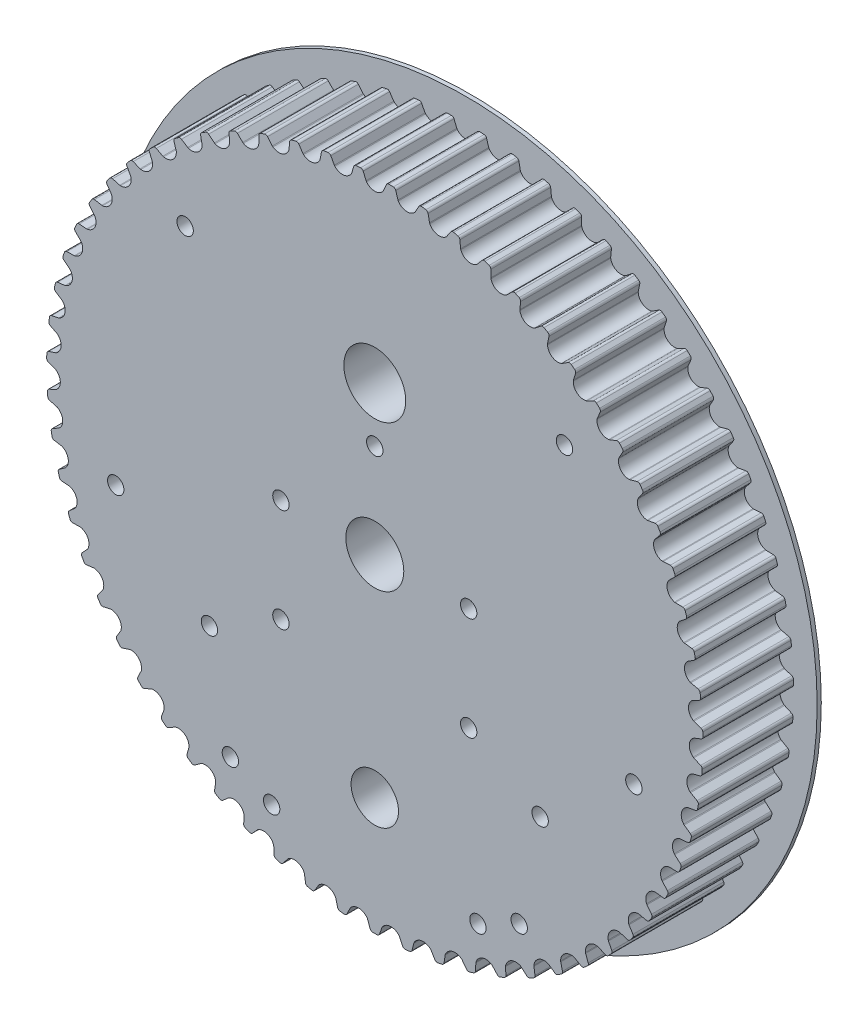
from build123d import *

# Parameters (mm, degrees)
BOSS_EXTRUDE1_DEPTH = 22
SKETCH2_R           = 85.214091318
BOSS_EXTRUDE2_DEPTH = 1
SKETCH3_R           = 7.025
SKETCH3_R_2         = 5.75
SKETCH3_R_3         = 7.5
CUT_EXTRUDE1_DEPTH  = 123.686114611
SKETCH4_R           = 1.985
CUT_EXTRUDE2_DEPTH  = 18


with BuildPart() as part:
    # Sketch1 → Boss-Extrude1 (new body)
    with BuildSketch(Plane.XY):
        with BuildLine():
            ThreePointArc((-2.00858237, 77.225966305), (-2.06415437, 77.308346172), (-2.108533634, 77.397257198))
            Line((-2.108533634, 77.397257198), (-2.806365183, 79.058376339))
            ThreePointArc((-2.806365183, 79.058376339), (-3.057533909, 79.355500397), (-3.433430091, 79.455852257))
            ThreePointArc((-3.433430091, 79.455852257), (-3.69885733, 79.443938437), (-3.964243287, 79.431137945))
            ThreePointArc((-3.964243287, 79.431137945), (-4.229584998, 79.417450921), (-4.494879503, 79.402877519))
            ThreePointArc((-4.494879503, 79.402877519), (-4.858915954, 79.265597157), (-5.079252563, 78.944941245))
            Line((-5.079252563, 78.944941245), (-5.608222375, 77.222594994))
            ThreePointArc((-5.608222375, 77.222594994), (-5.643528429, 77.129707039), (-5.690621893, 77.042203352))
            ThreePointArc((-5.690621893, 77.042203352), (-7.591122322, 75.861842835), (-9.687824439, 76.642222909))
            ThreePointArc((-9.687824439, 76.642222909), (-9.751322675, 76.718660228), (-9.804334089, 76.802710687))
            Line((-9.804334089, 76.802710687), (-10.664092012, 78.386093769))
            ThreePointArc((-10.664092012, 78.386093769), (-10.943596627, 78.656733022), (-11.327616714, 78.719159038))
            ThreePointArc((-11.327616714, 78.719159038), (-11.590538753, 78.680876402), (-11.853331429, 78.64171561))
            ThreePointArc((-11.853331429, 78.64171561), (-12.11599181, 78.601677097), (-12.378516965, 78.560761311))
            ThreePointArc((-12.378516965, 78.560761311), (-12.727075727, 78.3879168), (-12.914390416, 78.046915859))
            Line((-12.914390416, 78.046915859), (-13.26924135, 76.280459947))
            ThreePointArc((-13.26924135, 76.280459947), (-13.295123307, 76.184518226), (-13.333270199, 76.092760369))
            ThreePointArc((-13.333270199, 76.092760369), (-15.10680066, 74.729036594), (-17.270784557, 75.29677467))
            ThreePointArc((-17.270784557, 75.29677467), (-17.341577955, 75.366509771), (-17.402694666, 75.444864333))
            Line((-17.402694666, 75.444864333), (-18.415834303, 76.934774984))
            ThreePointArc((-18.415834303, 76.934774984), (-18.720896964, 77.176239697), (-19.109224393, 77.20011945))
            ThreePointArc((-19.109224393, 77.20011945), (-19.367028194, 77.135848468), (-19.624615838, 77.070716574))
            ThreePointArc((-19.624615838, 77.070716574), (-19.881984453, 77.004724493), (-20.139131164, 76.937872962))
            ThreePointArc((-20.139131164, 76.937872962), (-20.468748104, 76.73118211), (-20.621179254, 76.373225158))
            Line((-20.621179254, 76.373225158), (-20.798384643, 74.58021542))
            ThreePointArc((-20.798384643, 74.58021542), (-20.814585277, 74.482173443), (-20.843406476, 74.387073348))
            ThreePointArc((-20.843406476, 74.387073348), (-22.472340826, 72.853539614), (-24.682099858, 73.202993255))
            ThreePointArc((-24.682099858, 73.202993255), (-24.759484842, 73.265333081), (-24.828099445, 73.337213021))
            Line((-24.828099445, 73.337213021), (-25.984551758, 74.71884384))
            ThreePointArc((-25.984551758, 74.71884384), (-26.312140616, 74.928734228), (-26.700916015, 74.913830392))
            ThreePointArc((-26.700916015, 74.913830392), (-26.951039407, 74.824209818), (-27.200861999, 74.733754131))
            ThreePointArc((-27.200861999, 74.733754131), (-27.450381001, 74.642464341), (-27.69959363, 74.550341466))
            ThreePointArc((-27.69959363, 74.550341466), (-28.006992866, 74.311858458), (-28.123025549, 73.940503033))
            Line((-28.123025549, 73.940503033), (-28.120824246, 72.138759204))
            ThreePointArc((-28.120824246, 72.138759204), (-28.127182546, 72.039591358), (-28.146391615, 71.942094172))
            ThreePointArc((-28.146391615, 71.942094172), (-29.614540772, 70.253991426), (-31.848113362, 70.381687605))
            ThreePointArc((-31.848113362, 70.381687605), (-31.931320845, 70.436012594), (-32.006751418, 70.500703539))
            Line((-32.006751418, 70.500703539), (-33.295023065, 71.760323257))
            ThreePointArc((-33.295023065, 71.760323257), (-33.641882394, 71.936553336), (-34.027241938, 71.88301403))
            ThreePointArc((-34.027241938, 71.88301403), (-34.267199083, 71.768934554), (-34.506773772, 71.654054064))
            ThreePointArc((-34.506773772, 71.654054064), (-34.745963331, 71.538373844), (-34.98476509, 71.421895183))
            ThreePointArc((-34.98476509, 71.421895183), (-35.26689155, 71.153990171), (-35.345372581, 70.77292697))
            Line((-35.345372581, 70.77292697), (-35.163786463, 68.98035559))
            ThreePointArc((-35.163786463, 68.98035559), (-35.160239239, 68.881047449), (-35.169645269, 68.782122143))
            ThreePointArc((-35.169645269, 68.782122143), (-36.462418108, 66.956227509), (-38.697606007, 66.860897123))
            ThreePointArc((-38.697606007, 66.860897123), (-38.785809036, 66.90666737), (-38.867305915, 66.963526391))
            Line((-38.867305915, 66.963526391), (-40.274593474, 68.088616342))
            ThreePointArc((-40.274593474, 68.088616342), (-40.637276031, 68.229434657), (-41.015389843, 68.137791981))
            ThreePointArc((-41.015389843, 68.137791981), (-41.242795939, 68.000387375), (-41.469741725, 67.862223816))
            ThreePointArc((-41.469741725, 67.862223816), (-41.696224666, 67.723302847), (-41.922242237, 67.583626019))
            ThreePointArc((-41.922242237, 67.583626019), (-42.176292022, 67.288961563), (-42.21644142, 66.901977763))
            Line((-42.21644142, 66.901977763), (-41.857275173, 65.136394212))
            ThreePointArc((-41.857275173, 65.136394212), (-41.843857678, 65.037932745), (-41.843367187, 64.938562482))
            ThreePointArc((-41.843367187, 64.938562482), (-42.947915551, 62.993022521), (-45.162504458, 62.675613008))
            ThreePointArc((-45.162504458, 62.675613008), (-45.254826431, 62.712373626), (-45.341579664, 62.760835633))
            Line((-45.341579664, 62.760835633), (-46.853896879, 63.740214167))
            ThreePointArc((-46.853896879, 63.740214167), (-47.228798161, 63.844221204), (-47.595908377, 63.715385943))
            ThreePointArc((-47.595908377, 63.715385943), (-47.80850336, 63.556021795), (-48.020564753, 63.395948299))
            ThreePointArc((-48.020564753, 63.395948299), (-48.232090189, 63.235167241), (-48.443077306, 63.073680416))
            ThreePointArc((-48.443077306, 63.073680416), (-48.666525555, 62.755185023), (-48.667944298, 62.366126644))
            Line((-48.667944298, 62.366126644), (-48.134767477, 60.645078084))
            ThreePointArc((-48.134767477, 60.645078084), (-48.11161306, 60.548441845), (-48.101230924, 60.449614213))
            ThreePointArc((-48.101230924, 60.449614213), (-49.006577314, 58.403764575), (-51.17855765, 57.867430492))
            ThreePointArc((-51.17855765, 57.867430492), (-51.274081029, 57.894816138), (-51.365228424, 57.934399494))
            Line((-51.365228424, 57.934399494), (-52.967545206, 58.758333108))
            ThreePointArc((-52.967545206, 58.758333108), (-53.350939277, 58.824495197), (-53.70339739, 58.659747773))
            ThreePointArc((-53.70339739, 58.659747773), (-53.899068396, 58.480007918), (-54.094137835, 58.299615367))
            ThreePointArc((-54.094137835, 58.299615367), (-54.288603529, 58.118572134), (-54.482463308, 57.936880239))
            ThreePointArc((-54.482463308, 57.936880239), (-54.673089293, 57.597719261), (-54.635763281, 57.210452939))
            Line((-54.635763281, 57.210452939), (-53.933874836, 55.551043924))
            ThreePointArc((-53.933874836, 55.551043924), (-53.901213616, 55.457193328), (-53.881043017, 55.359890519))
            ThreePointArc((-53.881043017, 55.359890519), (-54.578189694, 53.234063777), (-56.685975343, 52.484135454))
            ThreePointArc((-56.685975343, 52.484135454), (-56.783750775, 52.501873957), (-56.878386467, 52.532185265))
            Line((-56.878386467, 52.532185265), (-58.554778273, 53.192485336))
            ThreePointArc((-58.554778273, 53.192485336), (-58.942854789, 53.220144929), (-59.277157912, 53.021122677))
            ThreePointArc((-59.277157912, 53.021122677), (-59.453960275, 52.822793448), (-59.630099072, 52.623874664))
            ThreePointArc((-59.630099072, 52.623874664), (-59.805572338, 52.424368545), (-59.980378113, 52.224277318))
            ThreePointArc((-59.980378113, 52.224277318), (-60.136287306, 51.867821488), (-60.060587502, 51.48619605))
            Line((-60.060587502, 51.48619605), (-59.196963116, 49.904918532))
            ThreePointArc((-59.196963116, 49.904918532), (-59.155119696, 49.814786308), (-59.125361097, 49.719975362))
            ThreePointArc((-59.125361097, 49.719975362), (-59.607379505, 47.535298937), (-61.630022345, 46.579229498))
            ThreePointArc((-61.630022345, 46.579229498), (-61.729078094, 46.587144566), (-61.826261552, 46.607882577))
            Line((-61.826261552, 46.607882577), (-63.560067646, 47.097986747))
            ThreePointArc((-63.560067646, 47.097986747), (-63.948969729, 47.08686895), (-64.261795408, 46.855549842))
            ThreePointArc((-64.261795408, 46.855549842), (-64.417971986, 46.640602325), (-64.573429595, 46.425134253))
            ThreePointArc((-64.573429595, 46.425134253), (-64.7281665, 46.209148029), (-64.882180973, 45.992646066))
            ThreePointArc((-64.882180973, 45.992646066), (-65.001823879, 45.622438002), (-64.888502621, 45.250246213))
            Line((-64.888502621, 45.250246213), (-63.871725381, 43.762815639))
            ThreePointArc((-63.871725381, 43.762815639), (-63.821115619, 43.677297561), (-63.782064776, 43.585920752))
            ThreePointArc((-63.782064776, 43.585920752), (-64.044164399, 41.36410694), (-65.961562497, 40.211398233))
            ThreePointArc((-65.961562497, 40.211398233), (-66.060914102, 40.209411201), (-66.159679472, 40.220369813))
            Line((-66.159679472, 40.220369813), (-67.933668512, 40.535407206))
            ThreePointArc((-67.933668512, 40.535407206), (-68.319531077, 40.485622513), (-68.60777031, 40.224305502))
            ThreePointArc((-68.60777031, 40.224305502), (-68.74176895, 39.994875943), (-68.875000363, 39.765))
            ThreePointArc((-68.875000363, 39.765), (-69.007463062, 39.53468024), (-69.139155569, 39.303919234))
            ThreePointArc((-69.139155569, 39.303919234), (-69.221343123, 38.923638231), (-69.071526649, 38.5645791))
            Line((-69.071526649, 38.5645791), (-67.911701744, 37.185778223))
            ThreePointArc((-67.911701744, 37.185778223), (-67.852828622, 37.105724209), (-67.80487364, 37.018689679))
            ThreePointArc((-67.80487364, 37.018689679), (-67.844449614, 34.781819864), (-69.637547006, 33.443928026))
            ThreePointArc((-69.637547006, 33.443928026), (-69.736207066, 33.432058643), (-69.835572775, 33.433128944))
            Line((-69.835572775, 33.433128944), (-71.632114059, 33.569968577))
            ThreePointArc((-71.632114059, 33.569968577), (-72.011102232, 33.48201177), (-72.271890367, 33.193293943))
            ThreePointArc((-72.271890367, 33.193293943), (-72.382379331, 32.951662514), (-72.492060434, 32.709663312))
            ThreePointArc((-72.492060434, 32.709663312), (-72.600932454, 32.467299037), (-72.708994175, 32.224572395))
            ThreePointArc((-72.708994175, 32.224572395), (-72.75290956, 31.837997856), (-72.568086813, 31.495639874))
            Line((-72.568086813, 31.495639874), (-71.276741104, 30.239171836))
            ThreePointArc((-71.276741104, 30.239171836), (-71.210189731, 30.165377498), (-71.153807206, 30.083550238))
            ThreePointArc((-71.153807206, 30.083550238), (-70.970466208, 27.853855436), (-72.621442287, 26.344077037))
            ThreePointArc((-72.621442287, 26.344077037), (-72.718430274, 26.322443267), (-72.81740878, 26.313614619))
            Line((-72.81740878, 26.313614619), (-74.618647475, 26.270896518))
            ThreePointArc((-74.618647475, 26.270896518), (-74.986994701, 26.145641752), (-75.217739908, 25.832392516))
            ThreePointArc((-75.217739908, 25.832392516), (-75.303621106, 25.58096066), (-75.388661841, 25.329243295))
            ThreePointArc((-75.388661841, 25.329243295), (-75.472861162, 25.07724323), (-75.556218131, 24.824963278))
            ThreePointArc((-75.556218131, 24.824963278), (-75.561424896, 24.435937154), (-75.343432728, 24.113682829))
            Line((-75.343432728, 24.113682829), (-73.933400189, 22.992034974))
            ThreePointArc((-73.933400189, 22.992034974), (-73.859831981, 22.925233714), (-73.79558227, 22.849426958))
            ThreePointArc((-73.79558227, 22.849426958), (-73.391146424, 20.64906688), (-74.883593049, 18.982406775))
            ThreePointArc((-74.883593049, 18.982406775), (-74.977945052, 18.951223623), (-75.075552662, 18.93258377))
            Line((-75.075552662, 18.93258377), (-76.863587248, 18.710732487))
            ThreePointArc((-76.863587248, 18.710732487), (-77.217632726, 18.5494246), (-77.416041757, 18.214757166))
            ThreePointArc((-77.416041757, 18.214757166), (-77.476461664, 17.956023725), (-77.536016856, 17.697089878))
            ThreePointArc((-77.536016856, 17.697089878), (-77.594706668, 17.437958512), (-77.652530446, 17.178632522))
            ThreePointArc((-77.652530446, 17.178632522), (-77.618976844, 16.791021131), (-77.369981759, 16.492073171))
            Line((-77.369981759, 16.492073171), (-75.855275927, 15.516392939))
            ThreePointArc((-75.855275927, 15.516392939), (-75.775422038, 15.457248658), (-75.703943683, 15.388215808))
            ThreePointArc((-75.703943683, 15.388215808), (-75.082432455, 13.239058619), (-76.401517019, 11.432080827))
            ThreePointArc((-76.401517019, 11.432080827), (-76.492295327, 11.391658204), (-76.587561973, 11.363392398))
            Line((-76.587561973, 11.363392398), (-78.344622159, 10.96461279))
            ThreePointArc((-78.344622159, 10.96461279), (-78.680847227, 10.768854933), (-78.844948203, 10.416095376))
            ThreePointArc((-78.844948203, 10.416095376), (-78.879306338, 10.15263176), (-78.912784101, 9.889054831))
            ThreePointArc((-78.912784101, 9.889054831), (-78.945381118, 9.625367529), (-78.977097026, 9.361572799))
            ThreePointArc((-78.977097026, 9.361572799), (-78.905116528, 8.979228396), (-78.627593151, 8.70655788))
            Line((-78.627593151, 8.70655788), (-77.023267853, 7.88654202))
            ThreePointArc((-77.023267853, 7.88654202), (-76.937921907, 7.83564252), (-76.859925292, 7.774069656))
            ThreePointArc((-76.859925292, 7.774069656), (-76.02751554, 5.697474646), (-77.160128389, 3.768137723))
            ThreePointArc((-77.160128389, 3.768137723), (-77.246430806, 3.718877369), (-77.338409685, 3.681266527))
            Line((-77.338409685, 3.681266527), (-79.047033017, 3.109521846))
            ThreePointArc((-79.047033017, 3.109521846), (-79.362096118, 2.881259547), (-79.49025813, 2.513913751))
            ThreePointArc((-79.49025813, 2.513913751), (-79.498213027, 2.248338379), (-79.505280645, 1.982737914))
            ThreePointArc((-79.505280645, 1.982737914), (-79.511460903, 1.717115319), (-79.516753735, 1.45147356))
            ThreePointArc((-79.516753735, 1.45147356), (-79.407061715, 1.078196055), (-79.103768198, 0.834512905))
            Line((-79.103768198, 0.834512905), (-77.425767939, 0.178311104))
            ThreePointArc((-77.425767939, 0.178311104), (-77.335778143, 0.136162246), (-77.252038432, 0.082661306))
            ThreePointArc((-77.252038432, 0.082661306), (-76.217003018, -1.90073339), (-77.151887737, -3.933254827))
            ThreePointArc((-77.151887737, -3.933254827), (-77.23285655, -3.990863341), (-77.320633535, -4.037445425))
            Line((-77.320633535, -4.037445425), (-78.963838947, -4.776472924))
            ThreePointArc((-78.963838947, -4.776472924), (-79.254608844, -5.034971091), (-79.34555816, -5.413252278))
            ThreePointArc((-79.34555816, -5.413252278), (-79.32703076, -5.678299998), (-79.30761799, -5.943284343))
            ThreePointArc((-79.30761799, -5.943284343), (-79.287320068, -6.208202354), (-79.26613722, -6.473051076))
            ThreePointArc((-79.26613722, -6.473051076), (-79.119823847, -6.833551883), (-78.793774457, -7.045825835))
            Line((-78.793774457, -7.045825835), (-77.058775958, -7.531691949))
            ThreePointArc((-77.058775958, -7.531691949), (-76.96503667, -7.564671269), (-76.876386108, -7.609568568))
            ThreePointArc((-76.876386108, -7.609568568), (-75.649011679, -9.480051083), (-76.376876962, -11.595556923))
            ThreePointArc((-76.376876962, -11.595556923), (-76.451707468, -11.660941057), (-76.534410191, -11.71603143))
            Line((-76.534410191, -11.71603143), (-78.09586677, -12.61499696))
            ThreePointArc((-78.09586677, -12.61499696), (-78.35945366, -12.901161924), (-78.412286386, -13.286618975))
            ThreePointArc((-78.412286386, -13.286618975), (-78.367460821, -13.54850488), (-78.321760597, -13.81023957))
            ThreePointArc((-78.321760597, -13.81023957), (-78.275186224, -14.071820124), (-78.227738222, -14.333243622))
            ThreePointArc((-78.227738222, -14.333243622), (-78.046257623, -14.677384912), (-77.700692786, -14.856139991))
            Line((-77.700692786, -14.856139991), (-75.925939242, -15.166841663))
            ThreePointArc((-75.925939242, -15.166841663), (-75.829382086, -15.190323683), (-75.736701721, -15.226171131))
            ThreePointArc((-75.736701721, -15.226171131), (-74.329186474, -16.965151769), (-74.842798471, -19.142617164))
            ThreePointArc((-74.842798471, -19.142617164), (-74.910746969, -19.215127103), (-74.987553495, -19.278178251))
            Line((-74.987553495, -19.278178251), (-76.451742783, -20.328147489))
            ThreePointArc((-76.451742783, -20.328147489), (-76.685527021, -20.639135214), (-76.699718081, -21.027937283))
            ThreePointArc((-76.699718081, -21.027937283), (-76.629039849, -21.284058633), (-76.55750636, -21.539942431))
            ThreePointArc((-76.55750636, -21.539942431), (-76.485118413, -21.795585823), (-76.411876815, -22.050985954))
            ThreePointArc((-76.411876815, -22.050985954), (-76.197032628, -22.375347496), (-75.835386721, -22.518807154))
            Line((-75.835386721, -22.518807154), (-74.03851643, -22.651256491))
            ThreePointArc((-74.03851643, -22.651256491), (-73.940101034, -22.665007835), (-73.844311965, -22.691449165))
            ThreePointArc((-73.844311965, -22.691449165), (-72.270644421, -24.281645156), (-72.564898624, -26.499429476))
            ThreePointArc((-72.564898624, -26.499429476), (-72.625289812, -26.578344583), (-72.695436802, -26.648729876))
            Line((-72.695436802, -26.648729876), (-74.047807028, -27.839267755))
            ThreePointArc((-74.047807028, -27.839267755), (-74.249465162, -28.171987505), (-74.224873518, -28.560270502))
            ThreePointArc((-74.224873518, -28.560270502), (-74.129045051, -28.808081849), (-74.03238923, -29.055571668))
            ThreePointArc((-74.03238923, -29.055571668), (-73.934907133, -29.302737198), (-73.836599848, -29.54957568))
            ThreePointArc((-73.836599848, -29.54957568), (-73.590527289, -29.850933824), (-73.216394513, -29.957672294))
            Line((-73.216394513, -29.957672294), (-71.415265579, -29.910552956))
            ThreePointArc((-71.415265579, -29.910552956), (-71.315970039, -29.914436957), (-71.218024262, -29.931209383))
            ThreePointArc((-71.218024262, -29.931209383), (-69.493844234, -31.356816644), (-69.565816213, -33.592878553))
            ThreePointArc((-69.565816213, -33.592878553), (-69.618049897, -33.677414533), (-69.680840198, -33.754434451))
            Line((-69.680840198, -33.754434451), (-70.9079509, -35.073708871))
            ThreePointArc((-70.9079509, -35.073708871), (-71.075478761, -35.424853928), (-71.012348816, -35.808758923))
            ThreePointArc((-71.012348816, -35.808758923), (-70.8923225, -36.045797405), (-70.771504955, -36.282433579))
            ThreePointArc((-70.771504955, -36.282433579), (-70.649897529, -36.518664806), (-70.527501579, -36.754488447))
            ThreePointArc((-70.527501579, -36.754488447), (-70.252646228, -37.02984816), (-69.869744883, -37.098804628))
            Line((-69.869744883, -37.098804628), (-68.082257733, -36.872584907))
            ThreePointArc((-68.082257733, -36.872584907), (-67.983068894, -36.866562964), (-67.883939837, -36.873499794))
            ThreePointArc((-67.883939837, -36.873499794), (-66.026383002, -38.12035), (-65.875357467, -40.35246651))
            ThreePointArc((-65.875357467, -40.35246651), (-65.918914524, -40.441783207), (-65.973724099, -40.524672291))
            Line((-65.973724099, -40.524672291), (-67.0633797, -41.95957171))
            ThreePointArc((-67.0633797, -41.95957171), (-67.195112319, -42.325652237), (-67.094071488, -42.701363809))
            ThreePointArc((-67.094071488, -42.701363809), (-66.951040198, -42.925273632), (-66.807261668, -43.148704365))
            ThreePointArc((-66.807261668, -43.148704365), (-66.662737502, -43.371653516), (-66.517469313, -43.594118596))
            ThreePointArc((-66.517469313, -43.594118596), (-66.216562807, -43.840743229), (-65.828698337, -43.871232375))
            Line((-65.828698337, -43.871232375), (-64.072617824, -43.468160543))
            ThreePointArc((-64.072617824, -43.468160543), (-63.974521468, -43.452292506), (-63.87519432, -43.449324799))
            ThreePointArc((-63.87519432, -43.449324799), (-61.902721912, -44.505026192), (-61.530199822, -46.711013526))
            ThreePointArc((-61.530199822, -46.711013526), (-61.564647364, -46.804223271), (-61.61093149, -46.892157731))
            Line((-61.61093149, -46.892157731), (-62.552302502, -48.428421475))
            ThreePointArc((-62.552302502, -48.428421475), (-62.646930663, -48.805799198), (-62.508983134, -49.169583358))
            ThreePointArc((-62.508983134, -49.169583358), (-62.34436838, -49.378139204), (-62.179057801, -49.586143942))
            ThreePointArc((-62.179057801, -49.586143942), (-62.013053241, -49.793595248), (-61.846356553, -50.000490808))
            ThreePointArc((-61.846356553, -50.000490808), (-61.522389436, -50.215929295), (-61.133416613, -50.207648104))
            Line((-61.133416613, -50.207648104), (-59.426195452, -49.631730072))
            ThreePointArc((-59.426195452, -49.631730072), (-59.330166505, -49.606173643), (-59.231628424, -49.593330893))
            ThreePointArc((-59.231628424, -49.593330893), (-57.163843761, -50.447391438), (-56.573527408, -52.605325504))
            ThreePointArc((-56.573527408, -52.605325504), (-56.598523079, -52.701501936), (-56.635821764, -52.793607841))
            Line((-56.635821764, -52.793607841), (-57.419552419, -54.41596783))
            ThreePointArc((-57.419552419, -54.41596783), (-57.476135664, -54.800892201), (-57.302652422, -55.149133496))
            ThreePointArc((-57.302652422, -55.149133496), (-57.118090219, -55.340262646), (-56.932890522, -55.530774142))
            ThreePointArc((-56.932890522, -55.530774142), (-56.747055396, -55.72066586), (-56.560586916, -55.90993568))
            ThreePointArc((-56.560586916, -55.90993568), (-56.216778918, -56.092046896), (-55.830563529, -56.045077669))
            Line((-55.830563529, -56.045077669), (-54.189168851, -55.302037168))
            ThreePointArc((-54.189168851, -55.302037168), (-54.096161693, -55.26704634), (-53.999391995, -55.244456184))
            ThreePointArc((-53.999391995, -55.244456184), (-51.856845649, -55.888387845), (-51.054601862, -57.976822123))
            ThreePointArc((-51.054601862, -57.976822123), (-51.069897244, -58.075009398), (-51.097839797, -58.170371358))
            Line((-51.097839797, -58.170371358), (-51.716141027, -59.862703849))
            ThreePointArc((-51.716141027, -59.862703849), (-51.734117007, -60.251349316), (-51.526822206, -60.580586769))
            ThreePointArc((-51.526822206, -60.580586769), (-51.324146817, -60.752389694), (-51.120898598, -60.923514561))
            ThreePointArc((-51.120898598, -60.923514561), (-50.91707982, -61.093959461), (-50.712692755, -61.263722491))
            ThreePointArc((-50.712692755, -61.263722491), (-50.352460794, -61.410696534), (-49.972841221, -61.325506073))
            Line((-49.972841221, -61.325506073), (-48.413585945, -60.422727774))
            ThreePointArc((-48.413585945, -60.422727774), (-48.324524922, -60.378650301), (-48.230485347, -60.34653725))
            ThreePointArc((-48.230485347, -60.34653725), (-46.034470906, -60.773940343), (-45.028272746, -62.772119037))
            ThreePointArc((-45.028272746, -62.772119037), (-45.033715825, -62.871341325), (-45.05202454, -62.96901159))
            Line((-45.05202454, -62.96901159), (-45.498751392, -64.714497422))
            ThreePointArc((-45.498751392, -64.714497422), (-45.477941452, -65.103001453), (-45.238895282, -65.409962954))
            ThreePointArc((-45.238895282, -65.409962954), (-45.020120985, -65.560732199), (-44.800844218, -65.710769721))
            ThreePointArc((-44.800844218, -65.710769721), (-44.581067429, -65.860073845), (-44.36079307, -66.008642905))
            ThreePointArc((-44.36079307, -66.008642905), (-43.987717294, -66.11901908), (-43.618466366, -65.996454046))
            Line((-43.618466366, -65.996454046), (-42.156847072, -64.942910166))
            ThreePointArc((-42.156847072, -64.942910166), (-42.072617311, -64.890184109), (-41.982242468, -64.848867317))
            ThreePointArc((-41.982242468, -64.848867317), (-39.75458491, -65.055494119), (-38.554432425, -66.94355843))
            ThreePointArc((-38.554432425, -66.94355843), (-38.549969107, -67.042829616), (-38.558462024, -67.141837494))
            Line((-38.558462024, -67.141837494), (-38.829174724, -68.923129246))
            ThreePointArc((-38.829174724, -68.923129246), (-38.769785684, -69.307630712), (-38.501363892, -69.589265541))
            ThreePointArc((-38.501363892, -69.589265541), (-38.268664964, -69.717502694), (-38.03553892, -69.84496173))
            ThreePointArc((-38.03553892, -69.84496173), (-37.801988361, -69.971641227), (-37.568015894, -70.09753977))
            ThreePointArc((-37.568015894, -70.09753977), (-37.185804097, -70.170221109), (-36.830591596, -70.011499609))
            Line((-36.830591596, -70.011499609), (-35.481134512, -68.817660739))
            ThreePointArc((-35.481134512, -68.817660739), (-35.402573128, -68.756810114), (-35.316761201, -68.706700205))
            ThreePointArc((-35.316761201, -68.706700205), (-33.079599989, -68.690497167), (-31.697420833, -70.449682663))
            ThreePointArc((-31.697420833, -70.449682663), (-31.683095476, -70.548016146), (-31.681688189, -70.647377653))
            Line((-31.681688189, -70.647377653), (-31.773696272, -72.446772047))
            ThreePointArc((-31.773696272, -72.446772047), (-31.676318367, -72.8234496), (-31.38118865, -73.076958742))
            ThreePointArc((-31.38118865, -73.076958742), (-31.136877758, -73.181389325), (-30.892219348, -73.28500313))
            ThreePointArc((-30.892219348, -73.28500313), (-30.647216149, -73.387799002), (-30.401870897, -73.489775792))
            ThreePointArc((-30.401870897, -73.489775792), (-30.014321672, -73.524039956), (-29.67667786, -73.330739435))
            Line((-29.67667786, -73.330739435), (-28.452794497, -72.008470482))
            ThreePointArc((-28.452794497, -72.008470482), (-28.380682267, -71.940100049), (-28.300286095, -71.88169504))
            ThreePointArc((-28.300286095, -71.88169504), (-26.075855141, -71.642823194), (-24.525386033, -73.2556463))
            ThreePointArc((-24.525386033, -73.2556463), (-24.501341009, -73.352064796), (-24.490047503, -73.450792433))
            Line((-24.490047503, -73.450792433), (-24.402436553, -75.250406279))
            ThreePointArc((-24.402436553, -75.250406279), (-24.268037567, -75.615516328), (-23.949133056, -75.838380296))
            ThreePointArc((-23.949133056, -75.838380296), (-23.695638272, -75.91796643), (-23.441879021, -75.996705244))
            ThreePointArc((-23.441879021, -75.996705244), (-23.187858135, -76.074595859), (-22.933578449, -76.151637405))
            ThreePointArc((-22.933578449, -76.151637405), (-22.544543434, -76.147143861), (-22.227823967, -75.921185426))
            Line((-22.227823967, -75.921185426), (-21.141677827, -74.483627694))
            ThreePointArc((-21.141677827, -74.483627694), (-21.076731436, -74.40841695), (-21.002550032, -74.342297294))
            ThreePointArc((-21.002550032, -74.342297294), (-18.81295673, -73.883130656), (-17.109606927, -75.333562412))
            ThreePointArc((-17.109606927, -75.333562412), (-17.076081206, -75.427107672), (-17.055013722, -75.524220239))
            Line((-17.055013722, -75.524220239), (-16.788654455, -77.306168165))
            ThreePointArc((-16.788654455, -77.306168165), (-16.618570107, -77.656082083), (-16.279060219, -77.846085954))
            ThreePointArc((-16.279060219, -77.846085954), (-16.018900887, -77.900036678), (-15.758562769, -77.953117959))
            ThreePointArc((-15.758562769, -77.953117959), (-15.498048769, -78.005329205), (-15.237361795, -78.056669834))
            ThreePointArc((-15.237361795, -78.056669834), (-14.850707394, -78.01346324), (-14.558059972, -77.757092568))
            Line((-14.558059972, -77.757092568), (-13.620445664, -76.218533151))
            ThreePointArc((-13.620445664, -76.218533151), (-13.563310579, -76.137229574), (-13.49608119, -76.064052399))
            ThreePointArc((-13.49608119, -76.064052399), (-11.363086703, -75.389154373), (-9.523784861, -76.662779735))
            ThreePointArc((-9.523784861, -76.662779735), (-9.481111637, -76.752522064), (-9.450479553, -76.847054413))
            Line((-9.450479553, -76.847054413), (-9.008019167, -78.593626622))
            ThreePointArc((-9.008019167, -78.593626622), (-8.803939831, -78.924866806), (-8.447198768, -79.080122237))
            ThreePointArc((-8.447198768, -79.080122237), (-8.182960469, -79.107901362), (-7.91863084, -79.134797565))
            ThreePointArc((-7.91863084, -79.134797565), (-7.654212831, -79.160810544), (-7.389709393, -79.185940009))
            ThreePointArc((-7.389709393, -79.185940009), (-7.009278353, -79.104449773), (-6.743611438, -78.82021479))
            Line((-6.743611438, -78.82021479), (-5.963847394, -77.195944583))
            ThreePointArc((-5.963847394, -77.195944583), (-5.915091447, -77.109356204), (-5.85548223, -77.029848778))
            ThreePointArc((-5.85548223, -77.029848778), (-3.800285215, -76.145926804), (-1.843311143, -77.230087912))
            ThreePointArc((-1.843311143, -77.230087912), (-1.791914521, -77.31513541), (-1.752022272, -77.406148036))
            Line((-1.752022272, -77.406148036), (-1.137858137, -79.099986307))
            ThreePointArc((-1.137858137, -79.099986307), (-0.901812046, -79.409260744), (-0.53138526, -79.528224736))
            ThreePointArc((-0.53138526, -79.528224736), (-0.265694113, -79.529556183), (0, -79.53))
            ThreePointArc((0, -79.53), (0.265694113, -79.529556183), (0.53138526, -79.528224736))
            ThreePointArc((0.53138526, -79.528224736), (0.901812046, -79.409260744), (1.137858137, -79.099986307))
            Line((1.137858137, -79.099986307), (1.752022272, -77.406148036))
            ThreePointArc((1.752022272, -77.406148036), (1.791914521, -77.31513541), (1.843311143, -77.230087912))
            ThreePointArc((1.843311143, -77.230087912), (3.800285215, -76.145926804), (5.85548223, -77.029848778))
            ThreePointArc((5.85548223, -77.029848778), (5.915091447, -77.109356204), (5.963847394, -77.195944583))
            Line((5.963847394, -77.195944583), (6.743611438, -78.82021479))
            ThreePointArc((6.743611438, -78.82021479), (7.009278353, -79.104449773), (7.389709393, -79.185940009))
            ThreePointArc((7.389709393, -79.185940009), (7.654212831, -79.160810544), (7.91863084, -79.134797565))
            ThreePointArc((7.91863084, -79.134797565), (8.182960469, -79.107901362), (8.447198768, -79.080122237))
            ThreePointArc((8.447198768, -79.080122237), (8.803939831, -78.924866806), (9.008019167, -78.593626622))
            Line((9.008019167, -78.593626622), (9.450479553, -76.847054413))
            ThreePointArc((9.450479553, -76.847054413), (9.481111637, -76.752522064), (9.523784861, -76.662779735))
            ThreePointArc((9.523784861, -76.662779735), (11.363086703, -75.389154373), (13.49608119, -76.064052399))
            ThreePointArc((13.49608119, -76.064052399), (13.563310579, -76.137229574), (13.620445664, -76.218533151))
            Line((13.620445664, -76.218533151), (14.558059972, -77.757092568))
            ThreePointArc((14.558059972, -77.757092568), (14.850707394, -78.01346324), (15.237361795, -78.056669834))
            ThreePointArc((15.237361795, -78.056669834), (15.498048769, -78.005329205), (15.758562769, -77.953117959))
            ThreePointArc((15.758562769, -77.953117959), (16.018900887, -77.900036678), (16.279060219, -77.846085954))
            ThreePointArc((16.279060219, -77.846085954), (16.618570107, -77.656082083), (16.788654455, -77.306168165))
            Line((16.788654455, -77.306168165), (17.055013722, -75.524220239))
            ThreePointArc((17.055013722, -75.524220239), (17.076081206, -75.427107672), (17.109606927, -75.333562412))
            ThreePointArc((17.109606927, -75.333562412), (18.81295673, -73.883130656), (21.002550032, -74.342297294))
            ThreePointArc((21.002550032, -74.342297294), (21.076731436, -74.40841695), (21.141677827, -74.483627694))
            Line((21.141677827, -74.483627694), (22.227823967, -75.921185426))
            ThreePointArc((22.227823967, -75.921185426), (22.544543434, -76.147143861), (22.933578449, -76.151637405))
            ThreePointArc((22.933578449, -76.151637405), (23.187858135, -76.074595859), (23.441879021, -75.996705244))
            ThreePointArc((23.441879021, -75.996705244), (23.695638272, -75.91796643), (23.949133056, -75.838380295))
            ThreePointArc((23.949133056, -75.838380295), (24.268037567, -75.615516328), (24.402436553, -75.250406279))
            Line((24.402436553, -75.250406279), (24.490047503, -73.450792433))
            ThreePointArc((24.490047503, -73.450792433), (24.501341009, -73.352064796), (24.525386033, -73.2556463))
            ThreePointArc((24.525386033, -73.2556463), (26.075855141, -71.642823194), (28.300286095, -71.88169504))
            ThreePointArc((28.300286095, -71.88169504), (28.380682267, -71.940100049), (28.452794497, -72.008470482))
            Line((28.452794497, -72.008470482), (29.67667786, -73.330739435))
            ThreePointArc((29.67667786, -73.330739435), (30.014321672, -73.524039956), (30.401870897, -73.489775792))
            ThreePointArc((30.401870897, -73.489775792), (30.647216149, -73.387799002), (30.892219348, -73.28500313))
            ThreePointArc((30.892219348, -73.28500313), (31.136877758, -73.181389325), (31.38118865, -73.076958742))
            ThreePointArc((31.38118865, -73.076958742), (31.676318367, -72.8234496), (31.773696272, -72.446772047))
            Line((31.773696272, -72.446772047), (31.681688189, -70.647377653))
            ThreePointArc((31.681688189, -70.647377653), (31.683095476, -70.548016146), (31.697420833, -70.449682663))
            ThreePointArc((31.697420833, -70.449682663), (33.079599989, -68.690497167), (35.316761201, -68.706700205))
            ThreePointArc((35.316761201, -68.706700205), (35.402573128, -68.756810114), (35.481134512, -68.817660739))
            Line((35.481134512, -68.817660739), (36.830591596, -70.011499609))
            ThreePointArc((36.830591596, -70.011499609), (37.185804097, -70.170221109), (37.568015894, -70.09753977))
            ThreePointArc((37.568015894, -70.09753977), (37.801988361, -69.971641227), (38.03553892, -69.84496173))
            ThreePointArc((38.03553892, -69.84496173), (38.268664964, -69.717502694), (38.501363892, -69.589265541))
            ThreePointArc((38.501363892, -69.589265541), (38.769785684, -69.307630712), (38.829174724, -68.923129246))
            Line((38.829174724, -68.923129246), (38.558462024, -67.141837494))
            ThreePointArc((38.558462024, -67.141837494), (38.549969107, -67.042829616), (38.554432425, -66.94355843))
            ThreePointArc((38.554432425, -66.94355843), (39.75458491, -65.055494119), (41.982242468, -64.848867317))
            ThreePointArc((41.982242468, -64.848867317), (42.072617311, -64.890184109), (42.156847072, -64.942910166))
            Line((42.156847072, -64.942910166), (43.618466366, -65.996454046))
            ThreePointArc((43.618466366, -65.996454046), (43.987717294, -66.11901908), (44.36079307, -66.008642905))
            ThreePointArc((44.36079307, -66.008642905), (44.581067429, -65.860073845), (44.800844218, -65.710769721))
            ThreePointArc((44.800844218, -65.710769721), (45.020120985, -65.560732199), (45.238895282, -65.409962954))
            ThreePointArc((45.238895282, -65.409962954), (45.477941452, -65.103001453), (45.498751392, -64.714497422))
            Line((45.498751392, -64.714497422), (45.052024541, -62.96901159))
            ThreePointArc((45.052024541, -62.96901159), (45.033715825, -62.871341325), (45.028272746, -62.772119037))
            ThreePointArc((45.028272746, -62.772119037), (46.034470906, -60.773940343), (48.230485347, -60.34653725))
            ThreePointArc((48.230485347, -60.34653725), (48.324524922, -60.378650301), (48.413585945, -60.422727774))
            Line((48.413585945, -60.422727774), (49.972841221, -61.325506073))
            ThreePointArc((49.972841221, -61.325506073), (50.352460794, -61.410696534), (50.712692755, -61.263722491))
            ThreePointArc((50.712692755, -61.263722491), (50.91707982, -61.093959461), (51.120898598, -60.923514561))
            ThreePointArc((51.120898598, -60.923514561), (51.324146817, -60.752389694), (51.526822206, -60.580586769))
            ThreePointArc((51.526822206, -60.580586769), (51.734117007, -60.251349316), (51.716141027, -59.862703849))
            Line((51.716141027, -59.862703849), (51.097839797, -58.170371358))
            ThreePointArc((51.097839797, -58.170371358), (51.069897244, -58.075009398), (51.054601863, -57.976822123))
            ThreePointArc((51.054601863, -57.976822123), (51.856845649, -55.888387845), (53.999391995, -55.244456184))
            ThreePointArc((53.999391995, -55.244456184), (54.096161693, -55.26704634), (54.189168851, -55.302037168))
            Line((54.189168851, -55.302037168), (55.830563529, -56.045077669))
            ThreePointArc((55.830563529, -56.045077669), (56.216778918, -56.092046896), (56.560586916, -55.90993568))
            ThreePointArc((56.560586916, -55.90993568), (56.747055396, -55.72066586), (56.932890522, -55.530774142))
            ThreePointArc((56.932890522, -55.530774142), (57.118090219, -55.340262646), (57.302652422, -55.149133496))
            ThreePointArc((57.302652422, -55.149133496), (57.476135664, -54.800892201), (57.419552419, -54.41596783))
            Line((57.419552419, -54.41596783), (56.635821764, -52.793607841))
            ThreePointArc((56.635821764, -52.793607841), (56.598523079, -52.701501936), (56.573527409, -52.605325504))
            ThreePointArc((56.573527409, -52.605325504), (57.163843761, -50.447391438), (59.231628424, -49.593330893))
            ThreePointArc((59.231628424, -49.593330893), (59.330166505, -49.606173643), (59.426195452, -49.631730072))
            Line((59.426195452, -49.631730072), (61.133416613, -50.207648104))
            ThreePointArc((61.133416613, -50.207648104), (61.522389436, -50.215929295), (61.846356553, -50.000490808))
            ThreePointArc((61.846356553, -50.000490808), (62.013053241, -49.793595248), (62.179057801, -49.586143942))
            ThreePointArc((62.179057801, -49.586143942), (62.34436838, -49.378139204), (62.508983134, -49.169583358))
            ThreePointArc((62.508983134, -49.169583358), (62.646930663, -48.805799198), (62.552302502, -48.428421475))
            Line((62.552302502, -48.428421475), (61.61093149, -46.892157731))
            ThreePointArc((61.61093149, -46.892157731), (61.564647364, -46.804223271), (61.530199822, -46.711013526))
            ThreePointArc((61.530199822, -46.711013526), (61.902721912, -44.505026192), (63.87519432, -43.449324799))
            ThreePointArc((63.87519432, -43.449324799), (63.974521468, -43.452292506), (64.072617824, -43.468160543))
            Line((64.072617824, -43.468160543), (65.828698337, -43.871232375))
            ThreePointArc((65.828698337, -43.871232375), (66.216562807, -43.840743229), (66.517469313, -43.594118596))
            ThreePointArc((66.517469313, -43.594118596), (66.662737502, -43.371653516), (66.807261668, -43.148704365))
            ThreePointArc((66.807261668, -43.148704365), (66.951040198, -42.925273632), (67.094071488, -42.701363809))
            ThreePointArc((67.094071488, -42.701363809), (67.195112319, -42.325652237), (67.0633797, -41.95957171))
            Line((67.0633797, -41.95957171), (65.973724099, -40.524672291))
            ThreePointArc((65.973724099, -40.524672291), (65.918914524, -40.441783207), (65.875357467, -40.35246651))
            ThreePointArc((65.875357467, -40.35246651), (66.026383002, -38.12035), (67.883939837, -36.873499794))
            ThreePointArc((67.883939837, -36.873499794), (67.983068894, -36.866562964), (68.082257733, -36.872584907))
            Line((68.082257733, -36.872584907), (69.869744883, -37.098804628))
            ThreePointArc((69.869744883, -37.098804628), (70.252646228, -37.02984816), (70.527501579, -36.754488447))
            ThreePointArc((70.527501579, -36.754488447), (70.649897529, -36.518664806), (70.771504955, -36.282433579))
            ThreePointArc((70.771504955, -36.282433579), (70.8923225, -36.045797405), (71.012348816, -35.808758923))
            ThreePointArc((71.012348816, -35.808758923), (71.075478761, -35.424853928), (70.9079509, -35.073708871))
            Line((70.9079509, -35.073708871), (69.680840198, -33.75443445))
            ThreePointArc((69.680840198, -33.75443445), (69.618049897, -33.677414533), (69.565816213, -33.592878553))
            ThreePointArc((69.565816213, -33.592878553), (69.493844234, -31.356816644), (71.218024262, -29.931209383))
            ThreePointArc((71.218024262, -29.931209383), (71.315970039, -29.914436957), (71.415265579, -29.910552956))
            Line((71.415265579, -29.910552956), (73.216394513, -29.957672294))
            ThreePointArc((73.216394513, -29.957672294), (73.590527289, -29.850933824), (73.836599848, -29.54957568))
            ThreePointArc((73.836599848, -29.54957568), (73.934907133, -29.302737198), (74.03238923, -29.055571668))
            ThreePointArc((74.03238923, -29.055571668), (74.129045051, -28.808081849), (74.224873518, -28.560270502))
            ThreePointArc((74.224873518, -28.560270502), (74.249465162, -28.171987505), (74.047807028, -27.839267755))
            Line((74.047807028, -27.839267755), (72.695436802, -26.648729876))
            ThreePointArc((72.695436802, -26.648729876), (72.625289812, -26.578344583), (72.564898624, -26.499429476))
            ThreePointArc((72.564898624, -26.499429476), (72.270644421, -24.281645156), (73.844311965, -22.691449165))
            ThreePointArc((73.844311965, -22.691449165), (73.940101034, -22.665007835), (74.03851643, -22.651256491))
            Line((74.03851643, -22.651256491), (75.835386721, -22.518807154))
            ThreePointArc((75.835386721, -22.518807154), (76.197032628, -22.375347496), (76.411876816, -22.050985954))
            ThreePointArc((76.411876816, -22.050985954), (76.485118413, -21.795585823), (76.55750636, -21.539942431))
            ThreePointArc((76.55750636, -21.539942431), (76.629039849, -21.284058633), (76.699718081, -21.027937283))
            ThreePointArc((76.699718081, -21.027937283), (76.685527021, -20.639135214), (76.451742783, -20.328147489))
            Line((76.451742783, -20.328147489), (74.987553495, -19.278178251))
            ThreePointArc((74.987553495, -19.278178251), (74.910746969, -19.215127103), (74.842798471, -19.142617164))
            ThreePointArc((74.842798471, -19.142617164), (74.329186474, -16.965151769), (75.736701721, -15.226171131))
            ThreePointArc((75.736701721, -15.226171131), (75.829382086, -15.190323683), (75.925939242, -15.166841663))
            Line((75.925939242, -15.166841663), (77.700692786, -14.856139991))
            ThreePointArc((77.700692786, -14.856139991), (78.046257623, -14.677384912), (78.227738222, -14.333243622))
            ThreePointArc((78.227738222, -14.333243622), (78.275186224, -14.071820124), (78.321760597, -13.81023957))
            ThreePointArc((78.321760597, -13.81023957), (78.367460821, -13.54850488), (78.412286386, -13.286618975))
            ThreePointArc((78.412286386, -13.286618975), (78.35945366, -12.901161924), (78.09586677, -12.61499696))
            Line((78.09586677, -12.61499696), (76.534410191, -11.71603143))
            ThreePointArc((76.534410191, -11.71603143), (76.451707468, -11.660941057), (76.376876962, -11.595556923))
            ThreePointArc((76.376876962, -11.595556923), (75.649011679, -9.480051083), (76.876386108, -7.609568568))
            ThreePointArc((76.876386108, -7.609568568), (76.96503667, -7.564671269), (77.058775958, -7.531691949))
            Line((77.058775958, -7.531691949), (78.793774457, -7.045825835))
            ThreePointArc((78.793774457, -7.045825835), (79.119823847, -6.833551883), (79.26613722, -6.473051076))
            ThreePointArc((79.26613722, -6.473051076), (79.287320068, -6.208202354), (79.30761799, -5.943284343))
            ThreePointArc((79.30761799, -5.943284343), (79.32703076, -5.678299998), (79.34555816, -5.413252278))
            ThreePointArc((79.34555816, -5.413252278), (79.254608844, -5.034971091), (78.963838947, -4.776472924))
            Line((78.963838947, -4.776472924), (77.320633535, -4.037445425))
            ThreePointArc((77.320633535, -4.037445425), (77.23285655, -3.990863341), (77.151887737, -3.933254827))
            ThreePointArc((77.151887737, -3.933254827), (76.217003018, -1.90073339), (77.252038432, 0.082661306))
            ThreePointArc((77.252038432, 0.082661306), (77.335778143, 0.136162246), (77.425767939, 0.178311104))
            Line((77.425767939, 0.178311104), (79.103768198, 0.834512905))
            ThreePointArc((79.103768198, 0.834512905), (79.407061715, 1.078196055), (79.516753735, 1.45147356))
            ThreePointArc((79.516753735, 1.45147356), (79.511460903, 1.717115319), (79.505280645, 1.982737914))
            ThreePointArc((79.505280645, 1.982737914), (79.498213027, 2.248338379), (79.49025813, 2.513913751))
            ThreePointArc((79.49025813, 2.513913751), (79.362096118, 2.881259547), (79.047033017, 3.109521846))
            Line((79.047033017, 3.109521846), (77.338409685, 3.681266527))
            ThreePointArc((77.338409685, 3.681266527), (77.246430806, 3.718877369), (77.160128389, 3.768137723))
            ThreePointArc((77.160128389, 3.768137723), (76.02751554, 5.697474646), (76.859925292, 7.774069656))
            ThreePointArc((76.859925292, 7.774069656), (76.937921907, 7.83564252), (77.023267853, 7.88654202))
            Line((77.023267853, 7.88654202), (78.627593151, 8.70655788))
            ThreePointArc((78.627593151, 8.70655788), (78.905116528, 8.979228396), (78.977097026, 9.361572799))
            ThreePointArc((78.977097026, 9.361572799), (78.945381118, 9.625367529), (78.912784101, 9.889054831))
            ThreePointArc((78.912784101, 9.889054831), (78.879306338, 10.15263176), (78.844948203, 10.416095376))
            ThreePointArc((78.844948203, 10.416095376), (78.680847227, 10.768854933), (78.344622159, 10.96461279))
            Line((78.344622159, 10.96461279), (76.587561973, 11.363392398))
            ThreePointArc((76.587561973, 11.363392398), (76.492295327, 11.391658204), (76.401517019, 11.432080827))
            ThreePointArc((76.401517019, 11.432080827), (75.082432455, 13.239058619), (75.703943683, 15.388215808))
            ThreePointArc((75.703943683, 15.388215808), (75.775422038, 15.457248658), (75.855275927, 15.516392939))
            Line((75.855275927, 15.516392939), (77.369981759, 16.492073171))
            ThreePointArc((77.369981759, 16.492073171), (77.618976844, 16.791021131), (77.652530446, 17.178632522))
            ThreePointArc((77.652530446, 17.178632522), (77.594706668, 17.437958512), (77.536016856, 17.697089878))
            ThreePointArc((77.536016856, 17.697089878), (77.476461664, 17.956023725), (77.416041757, 18.214757166))
            ThreePointArc((77.416041757, 18.214757166), (77.217632726, 18.5494246), (76.863587248, 18.710732487))
            Line((76.863587248, 18.710732487), (75.075552662, 18.93258377))
            ThreePointArc((75.075552662, 18.93258377), (74.977945052, 18.951223623), (74.883593049, 18.982406775))
            ThreePointArc((74.883593049, 18.982406775), (73.391146424, 20.64906688), (73.79558227, 22.849426958))
            ThreePointArc((73.79558227, 22.849426958), (73.859831981, 22.925233714), (73.933400189, 22.992034974))
            Line((73.933400189, 22.992034974), (75.343432728, 24.113682829))
            ThreePointArc((75.343432728, 24.113682829), (75.561424896, 24.435937154), (75.556218131, 24.824963278))
            ThreePointArc((75.556218131, 24.824963278), (75.472861162, 25.07724323), (75.388661841, 25.329243295))
            ThreePointArc((75.388661841, 25.329243295), (75.303621106, 25.58096066), (75.217739908, 25.832392516))
            ThreePointArc((75.217739908, 25.832392516), (74.986994701, 26.145641752), (74.618647475, 26.270896518))
            Line((74.618647475, 26.270896518), (72.81740878, 26.313614619))
            ThreePointArc((72.81740878, 26.313614619), (72.718430274, 26.322443267), (72.621442287, 26.344077037))
            ThreePointArc((72.621442287, 26.344077037), (70.970466208, 27.853855436), (71.153807206, 30.083550238))
            ThreePointArc((71.153807206, 30.083550238), (71.210189731, 30.165377498), (71.276741104, 30.239171836))
            Line((71.276741104, 30.239171836), (72.568086813, 31.495639874))
            ThreePointArc((72.568086813, 31.495639874), (72.75290956, 31.837997856), (72.708994175, 32.224572395))
            ThreePointArc((72.708994175, 32.224572395), (72.600932454, 32.467299037), (72.492060434, 32.709663312))
            ThreePointArc((72.492060434, 32.709663312), (72.38237933, 32.951662514), (72.271890367, 33.193293943))
            ThreePointArc((72.271890367, 33.193293943), (72.011102232, 33.48201177), (71.632114059, 33.569968577))
            Line((71.632114059, 33.569968577), (69.835572775, 33.433128944))
            ThreePointArc((69.835572775, 33.433128944), (69.736207066, 33.432058643), (69.637547006, 33.443928026))
            ThreePointArc((69.637547006, 33.443928026), (67.844449614, 34.781819864), (67.80487364, 37.018689679))
            ThreePointArc((67.80487364, 37.018689679), (67.852828622, 37.105724209), (67.911701744, 37.185778223))
            Line((67.911701744, 37.185778223), (69.071526649, 38.5645791))
            ThreePointArc((69.071526649, 38.5645791), (69.221343123, 38.923638231), (69.139155569, 39.303919234))
            ThreePointArc((69.139155569, 39.303919234), (69.007463062, 39.53468024), (68.875000363, 39.765))
            ThreePointArc((68.875000363, 39.765), (68.74176895, 39.994875943), (68.60777031, 40.224305502))
            ThreePointArc((68.60777031, 40.224305502), (68.319531077, 40.485622513), (67.933668512, 40.535407206))
            Line((67.933668512, 40.535407206), (66.159679472, 40.220369813))
            ThreePointArc((66.159679472, 40.220369813), (66.060914102, 40.209411201), (65.961562497, 40.211398233))
            ThreePointArc((65.961562497, 40.211398233), (64.044164399, 41.36410694), (63.782064776, 43.585920752))
            ThreePointArc((63.782064776, 43.585920752), (63.821115619, 43.677297561), (63.871725381, 43.762815639))
            Line((63.871725381, 43.762815639), (64.888502621, 45.250246213))
            ThreePointArc((64.888502621, 45.250246213), (65.001823879, 45.622438002), (64.882180973, 45.992646066))
            ThreePointArc((64.882180973, 45.992646066), (64.7281665, 46.209148029), (64.573429595, 46.425134253))
            ThreePointArc((64.573429595, 46.425134253), (64.417971986, 46.640602325), (64.261795408, 46.855549842))
            ThreePointArc((64.261795408, 46.855549842), (63.948969729, 47.08686895), (63.560067646, 47.097986747))
            Line((63.560067646, 47.097986747), (61.826261552, 46.607882577))
            ThreePointArc((61.826261552, 46.607882577), (61.729078094, 46.587144566), (61.630022345, 46.579229498))
            ThreePointArc((61.630022345, 46.579229498), (59.607379505, 47.535298937), (59.125361097, 49.719975362))
            ThreePointArc((59.125361097, 49.719975362), (59.155119696, 49.814786308), (59.196963116, 49.904918532))
            Line((59.196963116, 49.904918532), (60.060587502, 51.48619605))
            ThreePointArc((60.060587502, 51.48619605), (60.136287306, 51.867821488), (59.980378113, 52.224277318))
            ThreePointArc((59.980378113, 52.224277318), (59.805572338, 52.424368545), (59.630099072, 52.623874664))
            ThreePointArc((59.630099072, 52.623874664), (59.453960275, 52.822793448), (59.277157912, 53.021122677))
            ThreePointArc((59.277157912, 53.021122677), (58.942854789, 53.220144929), (58.554778273, 53.192485336))
            Line((58.554778273, 53.192485336), (56.878386467, 52.532185265))
            ThreePointArc((56.878386467, 52.532185265), (56.783750775, 52.501873957), (56.685975343, 52.484135454))
            ThreePointArc((56.685975343, 52.484135454), (54.578189694, 53.234063777), (53.881043017, 55.359890519))
            ThreePointArc((53.881043017, 55.359890519), (53.901213616, 55.457193328), (53.933874836, 55.551043924))
            Line((53.933874836, 55.551043924), (54.635763281, 57.210452939))
            ThreePointArc((54.635763281, 57.210452939), (54.673089293, 57.597719261), (54.482463308, 57.936880239))
            ThreePointArc((54.482463308, 57.936880239), (54.288603529, 58.118572134), (54.094137835, 58.299615367))
            ThreePointArc((54.094137835, 58.299615367), (53.899068396, 58.480007918), (53.70339739, 58.659747773))
            ThreePointArc((53.70339739, 58.659747773), (53.350939277, 58.824495197), (52.967545206, 58.758333108))
            Line((52.967545206, 58.758333108), (51.365228424, 57.934399494))
            ThreePointArc((51.365228424, 57.934399494), (51.274081029, 57.894816138), (51.17855765, 57.867430492))
            ThreePointArc((51.17855765, 57.867430492), (49.006577314, 58.403764575), (48.101230924, 60.449614213))
            ThreePointArc((48.101230924, 60.449614213), (48.11161306, 60.548441845), (48.134767477, 60.645078084))
            Line((48.134767477, 60.645078084), (48.667944298, 62.366126644))
            ThreePointArc((48.667944298, 62.366126644), (48.666525555, 62.755185023), (48.443077306, 63.073680416))
            ThreePointArc((48.443077306, 63.073680416), (48.232090189, 63.235167241), (48.020564753, 63.395948299))
            ThreePointArc((48.020564753, 63.395948299), (47.80850336, 63.556021795), (47.595908377, 63.715385943))
            ThreePointArc((47.595908377, 63.715385943), (47.228798161, 63.844221204), (46.853896879, 63.740214167))
            Line((46.853896879, 63.740214167), (45.341579664, 62.760835633))
            ThreePointArc((45.341579664, 62.760835633), (45.254826431, 62.712373626), (45.162504458, 62.675613008))
            ThreePointArc((45.162504458, 62.675613008), (42.947915551, 62.993022521), (41.843367187, 64.938562482))
            ThreePointArc((41.843367187, 64.938562482), (41.843857678, 65.037932745), (41.857275173, 65.136394212))
            Line((41.857275173, 65.136394212), (42.21644142, 66.901977763))
            ThreePointArc((42.21644142, 66.901977763), (42.176292022, 67.288961563), (41.922242237, 67.583626019))
            ThreePointArc((41.922242237, 67.583626019), (41.696224666, 67.723302847), (41.469741725, 67.862223816))
            ThreePointArc((41.469741725, 67.862223816), (41.242795939, 68.000387375), (41.015389843, 68.137791981))
            ThreePointArc((41.015389843, 68.137791981), (40.637276031, 68.229434657), (40.274593474, 68.088616342))
            Line((40.274593474, 68.088616342), (38.867305915, 66.963526391))
            ThreePointArc((38.867305915, 66.963526391), (38.785809036, 66.90666737), (38.697606007, 66.860897123))
            ThreePointArc((38.697606007, 66.860897123), (36.462418108, 66.956227509), (35.169645269, 68.782122143))
            ThreePointArc((35.169645269, 68.782122143), (35.160239239, 68.881047449), (35.163786463, 68.98035559))
            Line((35.163786463, 68.98035559), (35.345372581, 70.77292697))
            ThreePointArc((35.345372581, 70.77292697), (35.26689155, 71.153990171), (34.98476509, 71.421895183))
            ThreePointArc((34.98476509, 71.421895183), (34.745963331, 71.538373844), (34.506773772, 71.654054064))
            ThreePointArc((34.506773772, 71.654054064), (34.267199083, 71.768934554), (34.027241938, 71.88301403))
            ThreePointArc((34.027241938, 71.88301403), (33.641882394, 71.936553336), (33.295023065, 71.760323257))
            Line((33.295023065, 71.760323257), (32.006751418, 70.500703539))
            ThreePointArc((32.006751418, 70.500703539), (31.931320845, 70.436012594), (31.848113362, 70.381687605))
            ThreePointArc((31.848113362, 70.381687605), (29.614540772, 70.253991426), (28.146391615, 71.942094172))
            ThreePointArc((28.146391615, 71.942094172), (28.127182546, 72.039591358), (28.120824246, 72.138759204))
            Line((28.120824246, 72.138759204), (28.123025549, 73.940503033))
            ThreePointArc((28.123025549, 73.940503033), (28.006992866, 74.311858458), (27.69959363, 74.550341466))
            ThreePointArc((27.69959363, 74.550341466), (27.450381001, 74.642464341), (27.200861999, 74.733754131))
            ThreePointArc((27.200861999, 74.733754131), (26.951039407, 74.824209818), (26.700916015, 74.913830392))
            ThreePointArc((26.700916015, 74.913830392), (26.312140616, 74.928734228), (25.984551758, 74.71884384))
            Line((25.984551758, 74.71884384), (24.828099445, 73.337213021))
            ThreePointArc((24.828099445, 73.337213021), (24.759484842, 73.265333081), (24.682099858, 73.202993255))
            ThreePointArc((24.682099858, 73.202993255), (22.472340826, 72.853539614), (20.843406476, 74.387073348))
            ThreePointArc((20.843406476, 74.387073348), (20.814585277, 74.482173443), (20.798384643, 74.58021542))
            Line((20.798384643, 74.58021542), (20.621179254, 76.373225158))
            ThreePointArc((20.621179254, 76.373225158), (20.468748104, 76.73118211), (20.139131164, 76.937872962))
            ThreePointArc((20.139131164, 76.937872962), (19.881984453, 77.004724493), (19.624615838, 77.070716574))
            ThreePointArc((19.624615838, 77.070716574), (19.367028194, 77.135848468), (19.109224393, 77.20011945))
            ThreePointArc((19.109224393, 77.20011945), (18.720896964, 77.176239697), (18.415834303, 76.934774984))
            Line((18.415834303, 76.934774984), (17.402694666, 75.444864333))
            ThreePointArc((17.402694666, 75.444864333), (17.341577955, 75.366509771), (17.270784557, 75.29677467))
            ThreePointArc((17.270784557, 75.29677467), (15.10680066, 74.729036594), (13.333270199, 76.092760369))
            ThreePointArc((13.333270199, 76.092760369), (13.295123307, 76.184518226), (13.26924135, 76.280459947))
            Line((13.26924135, 76.280459947), (12.914390416, 78.046915859))
            ThreePointArc((12.914390416, 78.046915859), (12.727075727, 78.3879168), (12.378516965, 78.560761311))
            ThreePointArc((12.378516965, 78.560761311), (12.11599181, 78.601677097), (11.853331429, 78.64171561))
            ThreePointArc((11.853331429, 78.64171561), (11.590538753, 78.680876402), (11.327616714, 78.719159038))
            ThreePointArc((11.327616714, 78.719159038), (10.943596627, 78.656733022), (10.664092012, 78.386093769))
            Line((10.664092012, 78.386093769), (9.804334089, 76.802710687))
            ThreePointArc((9.804334089, 76.802710687), (9.751322675, 76.718660228), (9.687824439, 76.642222909))
            ThreePointArc((9.687824439, 76.642222909), (7.591122322, 75.861842835), (5.690621893, 77.042203352))
            ThreePointArc((5.690621893, 77.042203352), (5.643528429, 77.129707039), (5.608222375, 77.222594994))
            Line((5.608222375, 77.222594994), (5.079252563, 78.944941245))
            ThreePointArc((5.079252563, 78.944941245), (4.858915954, 79.265597157), (4.494879503, 79.402877519))
            ThreePointArc((4.494879503, 79.402877519), (4.229584998, 79.417450921), (3.964243287, 79.431137945))
            ThreePointArc((3.964243287, 79.431137945), (3.69885733, 79.443938437), (3.433430091, 79.455852257))
            ThreePointArc((3.433430091, 79.455852257), (3.057533909, 79.355500397), (2.806365183, 79.058376339))
            Line((2.806365183, 79.058376339), (2.108533634, 77.397257198))
            ThreePointArc((2.108533634, 77.397257198), (2.06415437, 77.308346172), (2.00858237, 77.225966305))
            ThreePointArc((2.00858237, 77.225966305), (0, 76.2407), (-2.00858237, 77.225966305))
        make_face()
    extrude(amount=BOSS_EXTRUDE1_DEPTH)

    # Sketch2 → Boss-Extrude2 (add)
    with BuildSketch(Plane(origin=(0, 0, 0), x_dir=(-1, 0, 0), z_dir=(0, 0, -1))):
        Circle(SKETCH2_R)
    extrude(amount=BOSS_EXTRUDE2_DEPTH)

    # Sketch3 → Cut-Extrude1 (cut, through all)
    with BuildSketch(Plane.XY.offset(22)):
        Circle(SKETCH3_R)
        with Locations((0, -51.05)):
            Circle(SKETCH3_R_2)
        with Locations((0, 36)):
            Circle(SKETCH3_R_3)
    extrude(amount=-CUT_EXTRUDE1_DEPTH, mode=Mode.SUBTRACT)

    # Sketch4 → Cut-Extrude2 (cut)
    with BuildSketch(Plane.XY.offset(22)):
        with Locations((-45.961940777, 45.961940777)):
            Circle(SKETCH4_R)
        with Locations((45.961940777, 45.961940777)):
            Circle(SKETCH4_R)
        with Locations((-25, -65)):
            Circle(SKETCH4_R)
        with Locations((25, -65)):
            Circle(SKETCH4_R)
        with Locations((-62.785178709, -16.823237932)):
            Circle(SKETCH4_R)
        with Locations((62.785178709, -16.823237932)):
            Circle(SKETCH4_R)
        with Locations((-35, -60)):
            Circle(SKETCH4_R)
        with Locations((35, -60)):
            Circle(SKETCH4_R)
        with Locations((-22.75, 0)):
            Circle(SKETCH4_R)
        with Locations((22.75, 0)):
            Circle(SKETCH4_R)
        with Locations((0, 22.75)):
            Circle(SKETCH4_R)
        with Locations((-22.75, -25)):
            Circle(SKETCH4_R)
        with Locations((22.75, -25)):
            Circle(SKETCH4_R)
        with Locations((-40.070508076, -35)):
            Circle(SKETCH4_R)
        with Locations((40.070508076, -35)):
            Circle(SKETCH4_R)
    extrude(amount=-CUT_EXTRUDE2_DEPTH, mode=Mode.SUBTRACT)


solid = part.part
